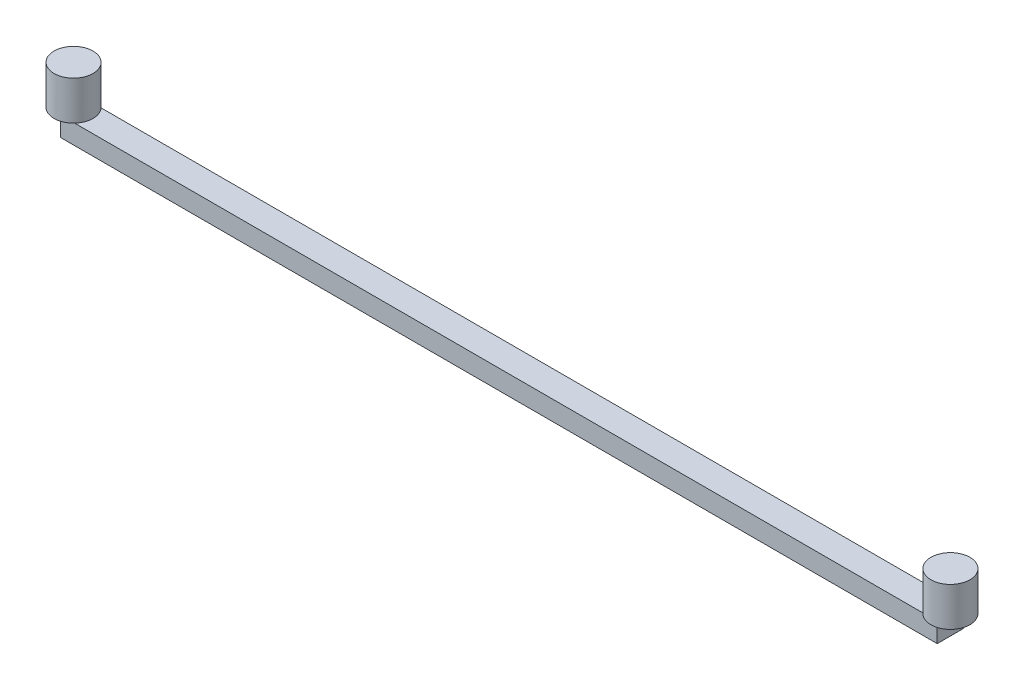
from build123d import *

# Parameters (mm, degrees)
SKETCH1_W           = 114.3
SKETCH1_H           = 3.45052473
BOSS_EXTRUDE1_DEPTH = 2.54
SKETCH2_R           = 2.54
BOSS_EXTRUDE2_DEPTH = 5.08
SKETCH3_R           = 2.54
BOSS_EXTRUDE3_DEPTH = 5.08


with BuildPart() as part:
    # Sketch1 → Boss-Extrude1 (new body)
    with BuildSketch(Plane(origin=(0, 0, 0), x_dir=(1, 0, 0), z_dir=(0, 1, 0))):
        Rectangle(SKETCH1_W, SKETCH1_H)
    extrude(amount=BOSS_EXTRUDE1_DEPTH)

    # Sketch2 → Boss-Extrude2 (add)
    with BuildSketch(Plane(origin=(0, 2.54, 0), x_dir=(1, 0, 0), z_dir=(0, 1, 0))):
        with Locations((-57.15, 0)):
            Circle(SKETCH2_R)
    extrude(amount=BOSS_EXTRUDE2_DEPTH)

    # Sketch3 → Boss-Extrude3 (add)
    with BuildSketch(Plane(origin=(0, 2.54, 0), x_dir=(1, 0, 0), z_dir=(0, 1, 0))):
        with Locations((57.15, 0)):
            Circle(SKETCH3_R)
    extrude(amount=BOSS_EXTRUDE3_DEPTH)


solid = part.part
